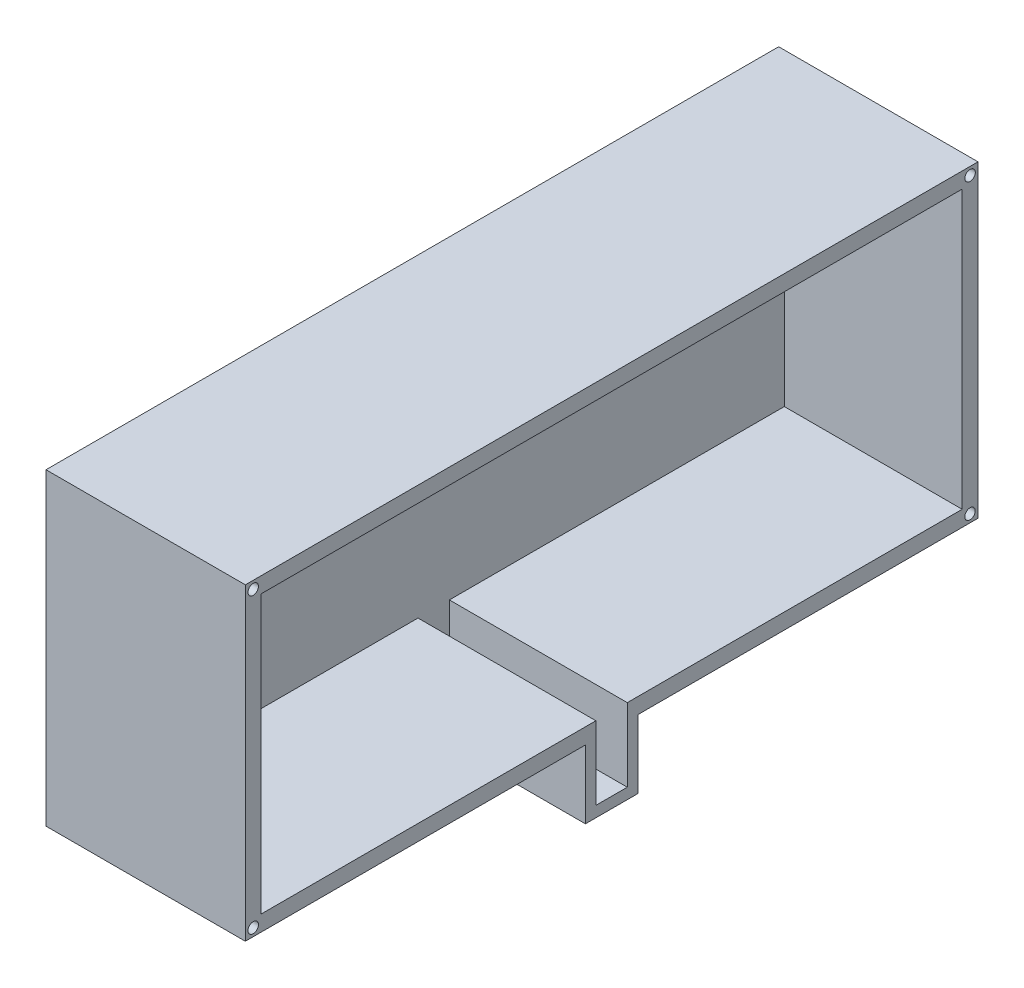
from build123d import *

# Parameters (mm, degrees)
SKETCH1_W           = 140
SKETCH1_H           = 53
BOSS_EXTRUDE1_DEPTH = 38.1
BOSS_EXTRUDE2_DEPTH = 45.4
CUT_EXTRUDE1_DEPTH  = 5
BOSS_EXTRUDE3_DEPTH = 45.4
BOSS_EXTRUDE4_DEPTH = 38.1
SKETCH11_W          = 134
SKETCH11_H          = 53
CUT_EXTRUDE2_DEPTH  = 34
SKETCH12_W          = 6
SKETCH12_H          = 14
CUT_EXTRUDE3_DEPTH  = 34
SKETCH13_W          = 6
SKETCH13_H          = 5
CUT_EXTRUDE4_DEPTH  = 6
CUT_EXTRUDE6_DEPTH  = 3
CUT_EXTRUDE7_DEPTH  = 3
SKETCH17_W          = 18
SKETCH17_H          = 7
BOSS_EXTRUDE5_DEPTH = 9
SKETCH21_W          = 2
SKETCH21_H          = 12
CUT_EXTRUDE10_DEPTH = 93.075528643
SKETCH23_RX         = 3.5
SKETCH23_RY         = 1.800693379
CUT_EXTRUDE12_DEPTH = 141.213025648
FILLET3_START       = -60
FILLET3_DEPTH       = 120


with BuildPart() as part:
    # Sketch1 → Boss-Extrude1 (new body)
    with BuildSketch(Plane(origin=(0, 0, 0), x_dir=(0, 0, -1), z_dir=(1, 0, 0))):
        Rectangle(SKETCH1_W, SKETCH1_H)
    extrude(amount=BOSS_EXTRUDE1_DEPTH)

    # Sketch2 → Boss-Extrude2 (add)
    with BuildSketch(Plane(origin=(38.1, 0, 0), x_dir=(0, 0, -1), z_dir=(1, 0, 0))):
        Polygon((0, -26.5), (5, -26.5), (5, -39.566040215), (-4.99956385, -39.566040215), (-4.99956385, -26.566040215), align=None)
    extrude(amount=-BOSS_EXTRUDE2_DEPTH)

    # Sketch3 → Cut-Extrude1 (cut)
    with BuildSketch(Plane.XZ.offset(39.566040215)):
        Polygon((-5.130369, 0), (-5.130369, 2.5), (-1.130369, 2.5), (-1.130369, -2.5), (-5.130369, -2.5), align=None)
    extrude(amount=-CUT_EXTRUDE1_DEPTH, mode=Mode.SUBTRACT)

    # Sketch7 → Boss-Extrude3 (add)
    with BuildSketch(Plane(origin=(38.1, 0, 0), x_dir=(0, 0, -1), z_dir=(1, 0, 0))):
        Polygon((-4.99956385, -26.566040215), (-4.99956385, -26.5), (0, -26.5), align=None)
    extrude(amount=-BOSS_EXTRUDE3_DEPTH)

    # Sketch8 → Boss-Extrude4 (add)
    with BuildSketch(Plane(origin=(38.1, 0, 0), x_dir=(0, 0, -1), z_dir=(1, 0, 0))):
        Polygon((-70, 26.5), (-70, 32.5), (70.030085777, 32.5), (70, 26.5), align=None)
    extrude(amount=-BOSS_EXTRUDE4_DEPTH)

    # Sketch11 → Cut-Extrude2 (cut)
    with BuildSketch(Plane(origin=(38.1, 0, 0), x_dir=(0, 0, -1), z_dir=(1, 0, 0))):
        with Locations((0.007630482, 3)):
            Rectangle(SKETCH11_W, SKETCH11_H)
    extrude(amount=-CUT_EXTRUDE2_DEPTH, mode=Mode.SUBTRACT)

    # Sketch12 → Cut-Extrude3 (cut)
    with BuildSketch(Plane(origin=(38.1, 0, 0), x_dir=(0, 0, -1), z_dir=(1, 0, 0))):
        with Locations((0.000218075, -30.5)):
            Rectangle(SKETCH12_W, SKETCH12_H)
    extrude(amount=-CUT_EXTRUDE3_DEPTH, mode=Mode.SUBTRACT)

    # Sketch13 → Cut-Extrude4 (cut)
    with BuildSketch(Plane(origin=(4.1, 0, 0), x_dir=(0, 0, -1), z_dir=(1, 0, 0))):
        with Locations((0.000218075, -35)):
            Rectangle(SKETCH13_W, SKETCH13_H)
    extrude(amount=-CUT_EXTRUDE4_DEPTH, mode=Mode.SUBTRACT)

    # Sketch15 → Cut-Extrude6 (cut)
    with BuildSketch(Plane(origin=(38.1, 0, 0), x_dir=(0, 0, -1), z_dir=(1, 0, 0))):
        with BuildLine():
            ThreePointArc((-67.496184759, 31), (-68.114088128, 31.924122375), (-69.204189088, 31.706208093))
            Line((-69.204189088, 31.706208093), (-67.78818043, 30.293791907))
            ThreePointArc((-67.78818043, 30.293791907), (-67.572062384, 30.617903369), (-67.496184759, 31))
        make_face()
        with BuildLine():
            Line((-67.78818043, 30.293791907), (-69.204189088, 31.706208093))
            ThreePointArc((-69.204189088, 31.706208093), (-69.202392852, 30.291995671), (-67.78818043, 30.293791907))
        make_face()
    extrude(amount=-CUT_EXTRUDE6_DEPTH, mode=Mode.SUBTRACT)

    # Sketch16 → Cut-Extrude7 (cut)
    with BuildSketch(Plane(origin=(38.1, 0, 0), x_dir=(0, 0, -1), z_dir=(1, 0, 0))):
        with BuildLine():
            ThreePointArc((69.228596491, 31.70446537), (67.814392759, 31.709738362), (67.809119767, 30.29553463))
            Line((67.809119767, 30.29553463), (69.228596491, 31.70446537))
        make_face()
        with BuildLine():
            Line((69.228596491, 31.70446537), (67.809119767, 30.29553463))
            ThreePointArc((67.809119767, 30.29553463), (68.899818519, 30.075408641), (69.518858129, 31))
            ThreePointArc((69.518858129, 31), (69.443449488, 31.38096039), (69.228596491, 31.70446537))
        make_face()
        with BuildLine():
            ThreePointArc((69.503815241, -25), (68.887086814, -24.076364303), (67.797609438, -24.291993387))
            Line((67.797609438, -24.291993387), (69.210021043, -25.708006613))
            ThreePointArc((69.210021043, -25.708006613), (69.427450938, -25.383271573), (69.503815241, -25))
        make_face()
        with BuildLine():
            Line((69.210021043, -25.708006613), (67.797609438, -24.291993387))
            ThreePointArc((67.797609438, -24.291993387), (67.795808628, -25.706205803), (69.210021043, -25.708006613))
        make_face()
        with BuildLine():
            ThreePointArc((-67.496184759, -25), (-67.572062384, -24.617903369), (-67.78818043, -24.293791907))
            Line((-67.78818043, -24.293791907), (-69.204189088, -25.706208093))
            ThreePointArc((-69.204189088, -25.706208093), (-68.114088128, -25.924122375), (-67.496184759, -25))
        make_face()
        with BuildLine():
            Line((-69.204189088, -25.706208093), (-67.78818043, -24.293791907))
            ThreePointArc((-67.78818043, -24.293791907), (-69.202392852, -24.291995671), (-69.204189088, -25.706208093))
        make_face()
    extrude(amount=-CUT_EXTRUDE7_DEPTH, mode=Mode.SUBTRACT)

    # Sketch17 → Boss-Extrude5 (add)
    with BuildSketch(Plane.ZY):
        with Locations((49.976158348, 3)):
            Rectangle(SKETCH17_W, SKETCH17_H)
        with Locations((-49.976158348, 3)):
            Rectangle(SKETCH17_W, SKETCH17_H)
    extrude(amount=BOSS_EXTRUDE5_DEPTH)

    # Sketch21 → Cut-Extrude10 (cut, through all)
    with BuildSketch(Plane(origin=(0, 6.5, 0), x_dir=(1, 0, 0), z_dir=(0, 1, 0))):
        with Locations((-4, -49.976158348)):
            Rectangle(SKETCH21_W, SKETCH21_H)
        with Locations((-4, 49.976158348)):
            Rectangle(SKETCH21_W, SKETCH21_H)
    extrude(amount=-CUT_EXTRUDE10_DEPTH, mode=Mode.SUBTRACT)

    # Sketch23 → Cut-Extrude12 (cut, through all)
    with BuildSketch(Plane.XY.offset(58.976158348)):
        with Locations(Location((-9, 3), (0, 0, 90))):
            Ellipse(SKETCH23_RX, SKETCH23_RY)
    extrude(amount=-CUT_EXTRUDE12_DEPTH, mode=Mode.SUBTRACT)

    # Fillet3: read off the stored shape, not the designer's step
    # Fillet3 outline → Fillet3 (cut)
    with BuildSketch(Plane.XY.offset(FILLET3_START)):
        with BuildLine():
            ThreePointArc((-7.452330452, -0.5), (-7.891056374, -0.239832369), (-7.873213162, 0.269921739))
            add(Edge.make_bspline(
                [(-9, -0.5), (-8.366981638, -0.5), (-7.873213162, 0.269921739)],
                knots=[3.141592654, 3.141592654, 3.141592654, 3.823261415, 3.823261415, 3.823261415], degree=2, weights=[1, 0.872894942, 0.856107875]))
            Line((-9, -0.5), (-7.452330452, -0.5))
        make_face()
        with BuildLine():
            add(Edge.make_bspline(
                [(-7.873213161, 5.730078261), (-8.366981638, 6.5), (-9, 6.5)],
                knots=[5.601516546, 5.601516546, 5.601516546, 6.283185307, 6.283185307, 6.283185307], degree=2, weights=[0.856107875, 0.872894942, 1]))
            ThreePointArc((-7.873213161, 5.730078261), (-7.891056374, 6.239832369), (-7.452330452, 6.5))
            Line((-7.452330452, 6.5), (-9, 6.5))
        make_face()
    extrude(amount=FILLET3_DEPTH, mode=Mode.SUBTRACT)


solid = part.part
